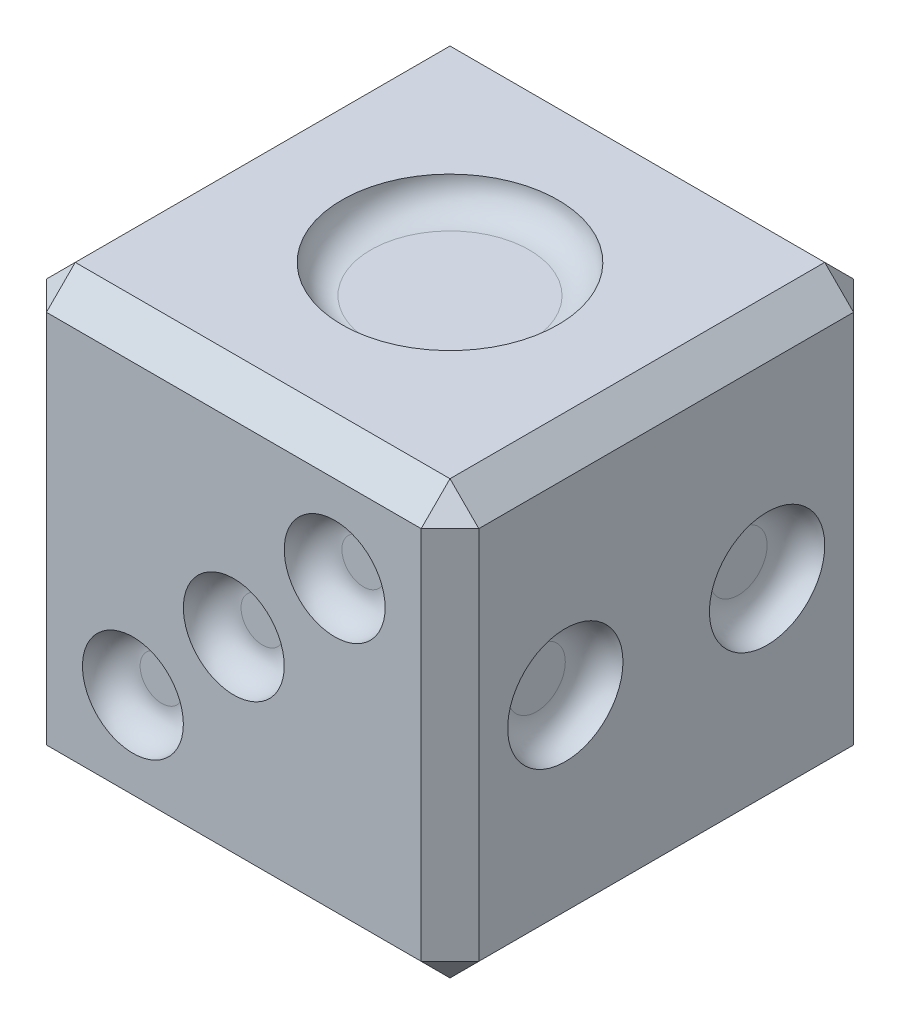
from build123d import *

# Parameters (mm, degrees)
SKETCH_2_W          = 30
SKETCH_2_H          = 30
EXTRUDE_1_DEPTH     = 30
CHAMFER_1_SIZE      = 2
SKETCH_3_R          = 7.5
CUT_EXTRUDE_1_DEPTH = 2
FILLET_1_R          = 2
SKETCH_4_R          = 3.5
CUT_EXTRUDE_2_DEPTH = 2
FILLET_2_R          = 2
SKETCH_6_R          = 3.5
CUT_EXTRUDE_3_DEPTH = 2
SKETCH_7_R          = 4
CUT_EXTRUDE_4_DEPTH = 2
FILLET_4_R          = 2
SKETCH_8_R          = 3.5
CUT_EXTRUDE_5_DEPTH = 2
FILLET_5_R          = 2
SKETCH_9_R          = 3.5
CUT_EXTRUDE_6_DEPTH = 2
SKETCH_12_R         = 3.5
CUT_EXTRUDE_7_DEPTH = 2
FILLET_7_R          = 2
CUT_EXTRUDE_START   = -2
SKETCH_13_R         = 3.5
CUT_EXTRUDE_9_DEPTH = 2
FILLET_8_R          = 2
FILLET_9_R          = 2


with BuildPart() as part:
    # ｽｹｯﾁ2 → ﾎﾞｽ - 押し出し1 (new body)
    with BuildSketch(Plane(origin=(0, 0, 0), x_dir=(1, 0, 0), z_dir=(0, 1, 0))):
        with Locations((15, 15)):
            Rectangle(SKETCH_2_W, SKETCH_2_H)
    extrude(amount=EXTRUDE_1_DEPTH)

    # 面取り1
    chamfer_1_edges = [part.edges().sort_by_distance(p)[0] for p in [
        (30, 30, -15),
        (15, 30, -30),
        (0, 30, -15),
        (15, 0, -30),
        (30, 0, -15),
        (15, 0, 0),
        (0, 0, -15),
        (0, 15, -30),
        (30, 15, -30),
        (30, 15, 0),
        (0, 15, 0),
        (15, 30, 0),
    ]]
    chamfer(chamfer_1_edges, length=CHAMFER_1_SIZE)

    # ｽｹｯﾁ3 → ｶｯﾄ - 押し出し1 (cut)
    with BuildSketch(Plane(origin=(0, 30, 0), x_dir=(1, 0, 0), z_dir=(0, 1, 0))):
        with Locations(Location((15, 15, 0), (0, 0, 270))):
            Circle(SKETCH_3_R)
    extrude(amount=-CUT_EXTRUDE_1_DEPTH, mode=Mode.SUBTRACT)

    # ﾌｨﾚｯﾄ1
    fillet_1_edges = [part.edges().sort_by_distance(p)[0] for p in [
        (15, 28, -22.5),
    ]]
    fillet(fillet_1_edges, radius=FILLET_1_R - 0.0001)  # a hair under: the kernel refuses the full size

    # ｽｹｯﾁ4 → ｶｯﾄ - 押し出し2 (cut)
    with BuildSketch(Plane.XY):
        with Locations((8, 8)):
            Circle(SKETCH_4_R)
        with Locations((15, 15)):
            Circle(SKETCH_4_R)
        with Locations((22, 22)):
            Circle(SKETCH_4_R)
    extrude(amount=-CUT_EXTRUDE_2_DEPTH, mode=Mode.SUBTRACT)

    # ﾌｨﾚｯﾄ2
    fillet_2_edges = [part.edges().sort_by_distance(p)[0] for p in [
        (11.5, 15, -2),
        (18.5, 22, -2),
        (4.5, 8, -2),
    ]]
    fillet(fillet_2_edges, radius=FILLET_2_R - 0.0001)  # a hair under: the kernel refuses the full size

    # ｽｹｯﾁ6 → ｶｯﾄ - 押し出し3 (cut)
    with BuildSketch(Plane(origin=(0, 0, -30), x_dir=(-1, 0, 0), z_dir=(0, 0, -1))):
        with Locations((-22, 8)):
            Circle(SKETCH_6_R)
        with Locations((-8, 22)):
            Circle(SKETCH_6_R)
    extrude(amount=-CUT_EXTRUDE_3_DEPTH, mode=Mode.SUBTRACT)

    # ｽｹｯﾁ7 → ｶｯﾄ - 押し出し4 (cut)
    with BuildSketch(Plane(origin=(30, 0, 0), x_dir=(0, 0, -1), z_dir=(1, 0, 0))):
        with Locations((8, 15)):
            Circle(SKETCH_7_R)
        with Locations((22, 15)):
            Circle(SKETCH_7_R)
    extrude(amount=-CUT_EXTRUDE_4_DEPTH, mode=Mode.SUBTRACT)

    # ﾌｨﾚｯﾄ4
    fillet_4_edges = [part.edges().sort_by_distance(p)[0] for p in [
        (28, 15, -18),
        (28, 15, -4),
    ]]
    fillet(fillet_4_edges, radius=FILLET_4_R - 0.0001)  # a hair under: the kernel refuses the full size

    # ｽｹｯﾁ8 → ｶｯﾄ - 押し出し5 (cut)
    with BuildSketch(Plane.ZY):
        with Locations((-22, 22)):
            Circle(SKETCH_8_R)
        with Locations((-8, 22)):
            Circle(SKETCH_8_R)
        with Locations((-22, 8)):
            Circle(SKETCH_8_R)
        with Locations((-8, 8)):
            Circle(SKETCH_8_R)
    extrude(amount=-CUT_EXTRUDE_5_DEPTH, mode=Mode.SUBTRACT)

    # ﾌｨﾚｯﾄ5
    fillet_5_edges = [part.edges().sort_by_distance(p)[0] for p in [
        (2, 22, -11.5),
        (2, 8, -25.5),
        (2, 8, -11.5),
        (2, 22, -25.5),
    ]]
    fillet(fillet_5_edges, radius=FILLET_5_R - 0.0001)  # a hair under: the kernel refuses the full size

    # ｽｹｯﾁ9 → ｶｯﾄ - 押し出し6 (cut)
    with BuildSketch(Plane.XZ):
        with Locations(Location((8, -7, 0), (0, 0, 270))):
            Circle(SKETCH_9_R)
        with Locations(Location((22, -7, 0), (0, 0, 270))):
            Circle(SKETCH_9_R)
        with Locations(Location((22, -23, 0), (0, 0, 270))):
            Circle(SKETCH_9_R)
        with Locations(Location((8, -23, 0), (0, 0, 270))):
            Circle(SKETCH_9_R)
        with Locations(Location((8, -15, 0), (0, 0, 270))):
            Circle(SKETCH_9_R)
        with Locations(Location((22, -15, 0), (0, 0, 270))):
            Circle(SKETCH_9_R)
    extrude(amount=-CUT_EXTRUDE_6_DEPTH, mode=Mode.SUBTRACT)

    # ｽｹｯﾁ12 → ｶｯﾄ - 押し出し7 (cut)
    with BuildSketch(Plane.ZY):
        with Locations((-15, 15)):
            Circle(SKETCH_12_R)
    extrude(amount=-CUT_EXTRUDE_7_DEPTH, mode=Mode.SUBTRACT)

    # ﾌｨﾚｯﾄ7
    fillet_7_edges = [part.edges().sort_by_distance(p)[0] for p in [
        (2, 15, -18.5),
    ]]
    fillet(fillet_7_edges, radius=FILLET_7_R - 0.0001)  # a hair under: the kernel refuses the full size

    # ｽｹｯﾁ13 → ｶｯﾄ - 押し出し9 (cut)
    with BuildSketch(Plane(origin=(0, 0, -30), x_dir=(-1, 0, 0), z_dir=(0, 0, -1)).offset(CUT_EXTRUDE_START)):
        with Locations((-22, 22)):
            Circle(SKETCH_13_R)
        with Locations((-8, 8)):
            Circle(SKETCH_13_R)
    extrude(amount=CUT_EXTRUDE_9_DEPTH, mode=Mode.SUBTRACT)

    # ﾌｨﾚｯﾄ8
    fillet_8_edges = [part.edges().sort_by_distance(p)[0] for p in [
        (25.5, 22, -28),
        (11.5, 8, -28),
        (25.5, 8, -28),
        (11.5, 22, -28),
    ]]
    fillet(fillet_8_edges, radius=FILLET_8_R - 0.0001)  # a hair under: the kernel refuses the full size

    # ﾌｨﾚｯﾄ9
    fillet_9_edges = [part.edges().sort_by_distance(p)[0] for p in [
        (8, 2, -3.5),
        (22, 2, -3.5),
        (22, 2, -19.5),
        (8, 2, -19.5),
        (22, 2, -11.5),
        (8, 2, -11.5),
    ]]
    fillet(fillet_9_edges, radius=FILLET_9_R - 0.0001)  # a hair under: the kernel refuses the full size


solid = part.part
